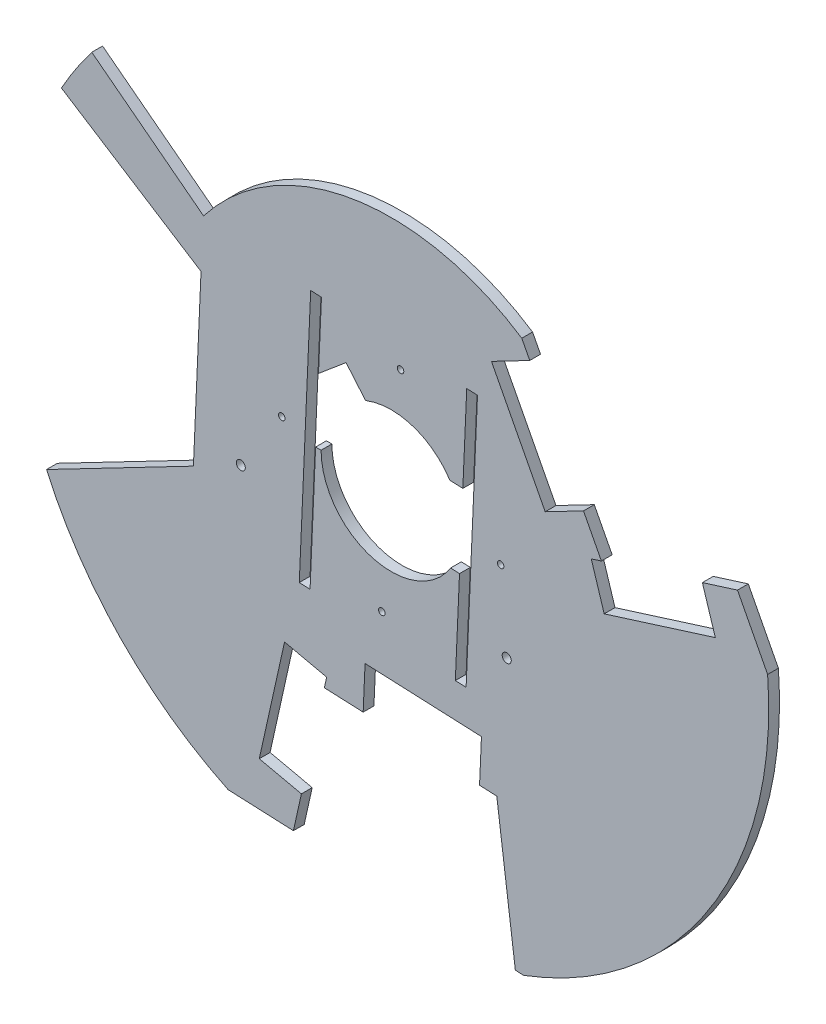
from build123d import *

# Parameters (mm, degrees)
ESQUISSE1_R             = 4.7
BOSS_EXTRU_1_DEPTH      = 5
ENL_V_START             = -10
ENL_V_MAT_EXTRU_1_DEPTH = 10
ENL_V_MAT_EXTRU_2_DEPTH = 10
ENL_V_MAT_EXTRU_3_DEPTH = 10
TROU_TARAUD_M51_D       = 4.2
ESQUISSE7_R             = 1.5
ENL_V_MAT_EXTRU_4_DEPTH = 10


with BuildPart() as part:
    # Esquisse1 → Boss.-Extru.1 (new body)
    with BuildSketch(Plane.XY):
        with BuildLine():
            ThreePointArc((61.384605816, -163.880841372), (147.549372919, -94.096665994), (174.481446525, 13.461976776))
            Line((174.481446525, 13.461976776), (160.509166102, 40.333250621))
            Line((160.509166102, 40.333250621), (97.428399446, 20.476493551))
            Line((97.428399446, 20.476493551), (60.521806411, 91.454683092))
            Line((60.521806411, 91.454683092), (113.006926452, 131.688824037))
            Line((113.006926452, 131.688824037), (111.232668913, 135.101048724))
            ThreePointArc((111.232668913, 135.101048724), (-147.549372919, 94.096665994), (-75.582309389, -157.836353567))
            Line((-75.582309389, -157.836353567), (-45.324963396, -159.171640695))
            Line((-45.324963396, -159.171640695), (-30.981036128, -94.613715745))
            Line((-30.981036128, -94.613715745), (48.941175647, -98.140763381))
            Line((48.941175647, -98.140763381), (57.542403784, -163.71128113))
            Line((57.542403784, -163.71128113), (61.384605816, -163.880841372))
        make_face()
        with Locations((-45.530301203, -113.99110802)):
            Circle(ESQUISSE1_R, mode=Mode.SUBTRACT)
        with BuildLine():
            Line((-20.91966999, 40.95026504), (-11.899961997, 30.243030676))
            ThreePointArc((-11.899961997, 30.243030676), (9.877796967, 30.962543937), (27.21544776, 17.764273225))
            Line((27.21544776, 17.764273225), (33.203827505, 17.5))
            Line((33.203827505, 17.5), (35.013781495, 58.513204539))
            Line((35.013781495, 58.513204539), (40.008919731, 58.292764062))
            Line((40.008919731, 58.292764062), (34.718348278, -61.590553601))
            Line((34.718348278, -61.590553601), (29.723210042, -61.370113123))
            Line((29.723210042, -61.370113123), (31.660744165, -17.465967651))
            Line((31.660744165, -17.465967651), (27.523349483, -17.283380261))
            ThreePointArc((27.523349483, -17.283380261), (-8.99280662, -31.231065129), (-32.5, 0))
            Line((-32.5, 0), (-35.034065472, 0))
            Line((-35.034065472, 0), (-37.611253378, -58.398575491))
            Line((-37.611253378, -58.398575491), (-42.606391614, -58.178135013))
            Line((-42.606391614, -58.178135013), (-37.315820161, 61.705182649))
            Line((-37.315820161, 61.705182649), (-32.320681925, 61.484742172))
            Line((-32.320681925, 61.484742172), (-33.702084088, 30.182438475))
            Line((-33.702084088, 30.182438475), (-20.91966999, 40.95026504))
        make_face(mode=Mode.SUBTRACT)
        with Locations((14.416088947, -86.607403569)):
            Circle(ESQUISSE1_R, mode=Mode.SUBTRACT)
        with Locations((67.796167173, 55.788401035)):
            Circle(ESQUISSE1_R, mode=Mode.SUBTRACT)
        with Locations((121.484345953, 17.565156526)):
            Circle(ESQUISSE1_R, mode=Mode.SUBTRACT)
    extrude(amount=BOSS_EXTRU_1_DEPTH)

    # Esquisse2 → Enlèv. mat.-Extru.1 (cut)
    with BuildSketch(Plane.XY.offset(5).offset(ENL_V_START)):
        with BuildLine():
            Line((-88.148964429, 43.929034477), (-152.860619324, 85.197600084))
            ThreePointArc((-152.860619324, 85.197600084), (-174.829838257, 7.715416702), (-159.771465705, -71.400831554))
            Line((-159.771465705, -71.400831554), (-91.676012064, -35.993177298))
            Line((-91.676012064, -35.993177298), (-88.148964429, 43.929034477))
        make_face()
    extrude(amount=ENL_V_MAT_EXTRU_1_DEPTH, mode=Mode.SUBTRACT)

    # Esquisse3 → Enlèv. mat.-Extru.2 (cut)
    with BuildSketch(Plane.XY.offset(5)):
        Polygon((40.948954466, -97.788058617), (-12.998538482, -95.407301464), (-12.116776573, -75.42674852), (41.830716375, -77.807505674), align=None)
        Polygon((-49.436008781, -85.46488415), (-29.912121681, -89.802836721), (-41.624593625, -142.517331891), (-61.148480724, -138.179379319), align=None)
        Polygon((64.212465714, 84.356864138), (89.124416013, 36.446586197), (71.379868627, 27.219937939), (46.467918329, 75.130215879), align=None)
        Polygon((98.732765194, -0.080397389), (92.727598771, 18.996761106), (144.235926707, 35.210710447), (150.24109313, 16.133551952), align=None)
    extrude(amount=-ENL_V_MAT_EXTRU_2_DEPTH, mode=Mode.SUBTRACT)

    # Esquisse4 → Enlèv. mat.-Extru.3 (cut)
    with BuildSketch(Plane.XY.offset(5).offset(ENL_V_START)):
        with BuildLine():
            Line((-138.786838194, 106.59837496), (-86.973339578, 66.801843637))
            ThreePointArc((-86.973339578, 66.801843637), (-18.079312073, 108.166476256), (60.521806411, 91.454683092))
            Line((60.521806411, 91.454683092), (113.006926452, 131.688824037))
            Line((113.006926452, 131.688824037), (111.232668913, 135.101048724))
            ThreePointArc((111.232668913, 135.101048724), (-19.821923825, 173.873779898), (-138.786838194, 106.59837496))
        make_face()
    extrude(amount=ENL_V_MAT_EXTRU_3_DEPTH, mode=Mode.SUBTRACT)

    # Trou taraudé M51 (through all)
    with Locations(Plane(origin=(0, 0, 5), x_dir=(0.9990276471851475, -0.04408809544206669, 0), z_dir=(0, 0, 1))):
        with Locations((-68.568956805, -27.662548456), (55.280905682, -37.98337033), (-87.299337242, 135.559338217)):
            Hole(TROU_TARAUD_M51_D / 2)

    # Esquisse7 → Enlèv. mat.-Extru.4 (cut)
    with BuildSketch(Plane.XY.offset(5)):
        with Locations((-50.726423203, 4.339353524)):
            Circle(ESQUISSE7_R)
        with Locations((4.339353524, 50.726423203)):
            Circle(ESQUISSE7_R)
        with Locations((50.726423203, -4.339353524)):
            Circle(ESQUISSE7_R)
        with Locations((-4.339353524, -50.726423203)):
            Circle(ESQUISSE7_R)
    extrude(amount=-ENL_V_MAT_EXTRU_4_DEPTH, mode=Mode.SUBTRACT)


solid = part.part
